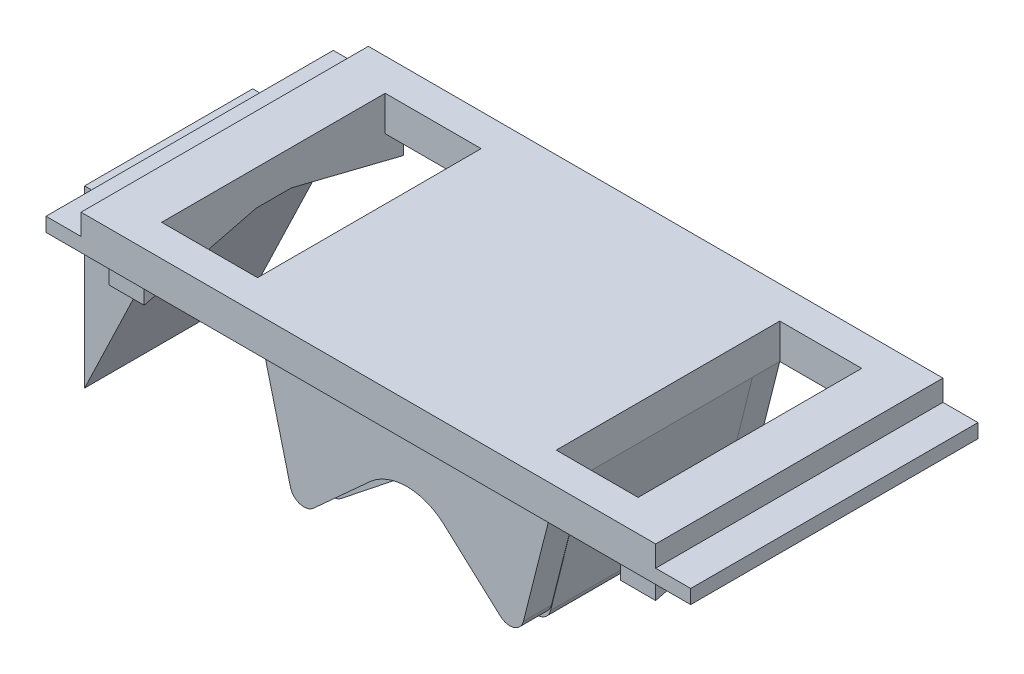
from build123d import *

# Parameters (mm, degrees)
SKETCH_1_W                = 95.051874556
SKETCH_1_H                = 3.903181728
EXTRUDE_1_DEPTH           = 25
SKETCH_1_H_2              = 4
EXTRUDE_1_2_DEPTH         = 25
CUT_EXTRUDE_15_DEPTH      = 32
EXTRUDE_START             = 74.552702475
EXTRUDE_5_OUTLINE_W       = 95.051874556
EXTRUDE_5_OUTLINE_H       = 25
EXTRUDE_5_DEPTH           = 24
CUT_EXTRUDE_16_DEPTH      = 158.81601617
CUT_EXTRUDE_16_DEPTH_BACK = 158.81601617
SKETCH_3_R                = 6.5
FILLET_2_R                = 2
FILLET_3_R                = 2
EXTRUDE_6_DEPTH           = 5
EXTRUDE_6_2_DEPTH         = 5
EXTRUDE_7_DEPTH           = 5
EXTRUDE_7_2_DEPTH         = 5
SKETCH_6_W                = 82
SKETCH_6_H                = 41
SKETCH_6_W_2              = 13.693142479
SKETCH_6_H_2              = 31.903181728
SKETCH_6_W_3              = 11.689861707
EXTRUDE_8_DEPTH           = 5
SKETCH_7_W                = 5
SKETCH_7_H                = 41
EXTRUDE_9_DEPTH           = 2
CUT_EXTRUDE_START         = 74.552702475
CUT_EXTRUDE_17_DEPTH      = 24


# Read off the part's stored shape, not the designer's step: Бобышка-Вытянуть5, Вырез-Вытянуть17
with BuildPart() as part:
    # Эскиз1 → Бобышка-Вытянуть1 (new body)
    with BuildSketch(Plane(origin=(0, 102.001425994, 0), x_dir=(1, 0, 0), z_dir=(0, 1, 0))):
        with Locations((66.267706326, -72.601111611)):
            Rectangle(SKETCH_1_W, SKETCH_1_H)
    extrude(amount=-EXTRUDE_1_DEPTH)


with BuildPart() as body_2:
    # Эскиз1 → Extrude 1 2 (new body)
    with BuildSketch(Plane(origin=(0, 102.001425994, 0), x_dir=(1, 0, 0), z_dir=(0, 1, 0))):
        with Locations((66.267706326, -100.552702475)):
            Rectangle(SKETCH_1_W, SKETCH_1_H_2)
    extrude(amount=-EXTRUDE_1_2_DEPTH)


with BuildPart() as cut_extrude_15_tool:
    # Эскиз2 → Вырез-Вытянуть15 (new body)
    with BuildSketch(Plane.XY.offset(102.552702475)):
        with BuildLine():
            Line((63.510266919, 89.850934142), (52.937126115, 80.258094246))
            Line((52.937126115, 80.258094246), (47.434911527, 102.001425994))
            Line((47.434911527, 102.001425994), (18.741769048, 102.001425994))
            Line((18.741769048, 102.001425994), (18.741769048, 77.001425994))
            Line((18.741769048, 77.001425994), (113.793643604, 77.001425994))
            Line((113.793643604, 77.001425994), (113.793643604, 102.001425994))
            Line((113.793643604, 102.001425994), (90.051907341, 102.001425994))
            Line((90.051907341, 102.001425994), (84.547557962, 80.262935973))
            Line((84.547557962, 80.262935973), (73.973273177, 89.850934142))
            ThreePointArc((73.973273177, 89.850934142), (68.741770048, 91.84906096), (63.510266919, 89.850934142))
        make_face()
    extrude(amount=-CUT_EXTRUDE_15_DEPTH)


with BuildPart() as part_1:
    add(part.part)

    # Вырез-Вытянуть15: cut by cut_extrude_15_tool
    add(cut_extrude_15_tool.part, mode=Mode.SUBTRACT)



with BuildPart() as body_2_1:
    add(body_2.part)

    # Вырез-Вытянуть15: cut by cut_extrude_15_tool
    add(cut_extrude_15_tool.part, mode=Mode.SUBTRACT)


with BuildPart() as part_2:
    add(part_1.part)

    add(body_2_1.part)  # Бобышка-Вытянуть5 merges body 2
    # Бобышка-Вытянуть5 outline → Бобышка-Вытянуть5 (add)
    with BuildSketch(Plane.XY.offset(EXTRUDE_START)):
        with Locations((66.267706326, 89.501425994)):
            Rectangle(EXTRUDE_5_OUTLINE_W, EXTRUDE_5_OUTLINE_H)
    extrude(amount=EXTRUDE_5_DEPTH)

    # Эскиз3 → Вырез-Вытянуть16 (cut, two sides: drawn at the far end of the back side and taken through both)
    with BuildSketch(Plane.XY.offset(110.052702475).offset(-CUT_EXTRUDE_16_DEPTH_BACK)):
        with BuildLine():
            Line((52.937126115, 79.748220071), (47.431470764, 102.001425994))
            Line((47.431470764, 102.001425994), (30.73376132, 102.001425994))
            Line((30.73376132, 102.001425994), (18.741769048, 77.001425994))
            Line((18.741769048, 77.001425994), (88.549097609, 77.001425994))
            ThreePointArc((88.549097609, 77.001425994), (92.13390173, 85.931402357), (99.789402086, 80.101426994))
            ThreePointArc((99.789402086, 80.101426994), (99.571745411, 78.493558676), (98.934442488, 77.001425994))
            Line((98.934442488, 77.001425994), (113.793643604, 77.001425994))
            Line((113.793643604, 77.001425994), (113.793643604, 102.001425994))
            Line((113.793643604, 102.001425994), (90.051907341, 102.001425994))
            Line((90.051907341, 102.001425994), (84.489905965, 79.748220071))
            Line((84.489905965, 79.748220071), (72.796657252, 89.081573622))
            ThreePointArc((72.796657252, 89.081573622), (74.598679081, 86.82040138), (75.241770048, 84.001426994))
            ThreePointArc((75.241770048, 84.001426994), (65.922795662, 78.144517962), (64.686882844, 89.081573622))
            Line((64.686882844, 89.081573622), (52.937126115, 79.748220071))
        make_face()
        with Locations((68.741770048, 84.001426994)):
            Circle(SKETCH_3_R)
    extrude(amount=CUT_EXTRUDE_16_DEPTH + CUT_EXTRUDE_16_DEPTH_BACK, mode=Mode.SUBTRACT)


with BuildPart() as cut_extrude_16_piece_1:
    # of the separate pieces the step leaves, piece 1, a body of its own (cut_extrude_16_pieces)
    add(part_2.part.solids().sort_by_distance((90.051907341, 102.001425994, 74.552702475))[0])

    # Скругление2
    fillet_2_edges = [cut_extrude_16_piece_1.edges().sort_by_distance(p)[0] for p in [
        (52.937126115, 80.258094246, 72.601111611),
        (84.547557962, 80.262935973, 72.601111611),
        (84.547557962, 80.262935973, 100.552702475),
        (52.937126115, 80.258094246, 100.552702475),
    ]]
    fillet(fillet_2_edges, radius=FILLET_2_R)

    # Скругление3
    fillet_3_edges = [cut_extrude_16_piece_1.edges().sort_by_distance(p)[0] for p in [
        (52.937126115, 79.748220071, 86.552702475),
        (84.489905965, 79.748220071, 86.552702475),
    ]]
    fillet(fillet_3_edges, radius=FILLET_3_R)



with BuildPart() as cut_extrude_16_piece_2:
    # of the separate pieces the step leaves, piece 2, a body of its own (cut_extrude_16_pieces)
    add(part_2.part.solids().sort_by_distance((18.741769048, 102.001425994, 74.552702475))[0])


with BuildPart() as cut_extrude_16_piece_3:
    # of the separate pieces the step leaves, piece 3, a body of its own (cut_extrude_16_pieces)
    add(part_2.part.solids().sort_by_distance((88.549097609, 77.001425994, 74.552702475))[0])

    # Вырез-Вытянуть17 outline → Вырез-Вытянуть17 (cut)
    with BuildSketch(Plane.XY.offset(CUT_EXTRUDE_START)):
        with BuildLine():
            Line((88.549097609, 77.001425994), (98.934442488, 77.001425994))
            ThreePointArc((98.934442488, 77.001425994), (93.741770049, 86.149059032), (88.549097609, 77.001425994))
        make_face()
    extrude(amount=CUT_EXTRUDE_17_DEPTH, mode=Mode.SUBTRACT)


with BuildPart() as body_4:
    # Эскиз4 → Бобышка-Вытянуть6 (new body)
    with BuildSketch(Plane(origin=(28.741769048, 0, 0), x_dir=(0, 0, -1), z_dir=(1, 0, 0))):
        Polygon((-105.052702475, 102.001425994), (-105.052702475, 98.001425994), (-89.052702475, 102.001425994), align=None)
    extrude(amount=EXTRUDE_6_DEPTH)


with BuildPart() as body_5:
    # Эскиз4 → Extrude 6 2 (new body)
    with BuildSketch(Plane(origin=(28.741769048, 0, 0), x_dir=(0, 0, -1), z_dir=(1, 0, 0))):
        Polygon((-68.052702475, 102.001425994), (-68.052702475, 98.001425994), (-84.052702475, 102.001425994), align=None)
    extrude(amount=EXTRUDE_6_2_DEPTH)


with BuildPart() as body_6:
    # Эскиз5 → Бобышка-Вытянуть7 (new body)
    with BuildSketch(Plane.ZY.offset(-106.741769048)):
        Polygon((105.052702475, 102.001425994), (105.052702475, 98.001425994), (89.052702475, 102.001425994), align=None)
    extrude(amount=EXTRUDE_7_DEPTH)


with BuildPart() as body_7:
    # Эскиз5 → Extrude 7 2 (new body)
    with BuildSketch(Plane.ZY.offset(-106.741769048)):
        Polygon((68.052702475, 102.001425994), (84.052702475, 102.001425994), (68.052702475, 98.001425994), align=None)
    extrude(amount=EXTRUDE_7_2_DEPTH)


with BuildPart() as cut_extrude_16_piece_1_1:
    add(cut_extrude_16_piece_1.part)

    add(body_4.part)  # Бобышка-Вытянуть8 merges body 4

    add(body_5.part)  # Бобышка-Вытянуть8 merges body 5

    add(body_6.part)  # Бобышка-Вытянуть8 merges body 6

    add(body_7.part)  # Бобышка-Вытянуть8 merges body 7
    # Эскиз6 → Бобышка-Вытянуть8 (add)
    with BuildSketch(Plane(origin=(0, 102.001425994, 0), x_dir=(1, 0, 0), z_dir=(0, 1, 0))):
        with Locations((67.741769048, -86.552702475)):
            Rectangle(SKETCH_6_W, SKETCH_6_H)
        with Locations((40.588340288, -86.601111611)):
            Rectangle(SKETCH_6_W_2, SKETCH_6_H_2, mode=Mode.SUBTRACT)
        with Locations((95.896838195, -86.601111611)):
            Rectangle(SKETCH_6_W_3, SKETCH_6_H_2, mode=Mode.SUBTRACT)
    extrude(amount=EXTRUDE_8_DEPTH)

    # Эскиз7 → Бобышка-Вытянуть9 (add)
    with BuildSketch(Plane(origin=(0, 102.001425994, 0), x_dir=(1, 0, 0), z_dir=(0, 1, 0))):
        with Locations((24.241769048, -86.552702475)):
            Rectangle(SKETCH_7_W, SKETCH_7_H)
        with Locations((111.241769048, -86.552702475)):
            Rectangle(SKETCH_7_W, SKETCH_7_H)
    extrude(amount=EXTRUDE_9_DEPTH)


solid = Compound([cut_extrude_16_piece_2.part, cut_extrude_16_piece_1_1.part])
